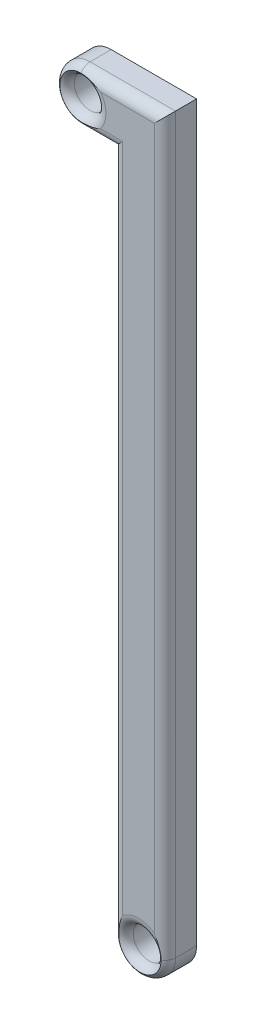
from build123d import *

# Parameters (mm, degrees)
SKETCH1_R           = 1.5
BOSS_EXTRUDE1_DEPTH = 3
FILLET1_R           = 1


with BuildPart() as part:
    # Sketch1 → Boss-Extrude1 (new body)
    with BuildSketch(Plane.XY):
        with BuildLine():
            Line((3.231167374, -4.499889348), (6.321167374, -4.499889348))
            Line((6.321167374, -4.499889348), (6.321167374, -68.999889348))
            ThreePointArc((6.321167374, -68.999889348), (8.821167374, -71.499889348), (11.321167374, -68.999889348))
            Line((11.321167374, -68.999889348), (11.321167374, 0.500110652))
            Line((11.321167374, 0.500110652), (3.231167374, 0.500110652))
            ThreePointArc((3.231167374, 0.500110652), (0.731167374, -1.999889348), (3.231167374, -4.499889348))
        make_face()
        with Locations((3.231167374, -1.999889348)):
            Circle(SKETCH1_R, mode=Mode.SUBTRACT)
        with Locations((8.821167374, -68.999889348)):
            Circle(SKETCH1_R, mode=Mode.SUBTRACT)
    extrude(amount=BOSS_EXTRUDE1_DEPTH)

    # Fillet1
    # the kernel refuses this fillet: 1 mm, written as the material it takes off along each edge
    with BuildSketch(Plane(origin=(8.821167374, -68.999889348, 3), x_dir=(1, 0, 0), z_dir=(0, -1, 0))) as fillet1_piece_1:
        with BuildLine():
            CenterArc((1.5 + FILLET1_R, -FILLET1_R), FILLET1_R, 90, 90)
            Line((1.5 + FILLET1_R, 0), (1.5, 0))
            Line((1.5, 0), (1.5, -FILLET1_R))
        make_face()
    revolve(axis=Axis((8.821167374, -68.999889348, 3), (0, 0, 1)), mode=Mode.SUBTRACT)
    with BuildSketch(Plane(origin=(3.231167374, -1.999889348, 3), x_dir=(1, 0, 0), z_dir=(0, -1, 0))) as fillet1_piece_2:
        with BuildLine():
            CenterArc((1.5 + FILLET1_R, -FILLET1_R), FILLET1_R, 90, 90)
            Line((1.5 + FILLET1_R, 0), (1.5, 0))
            Line((1.5, 0), (1.5, -FILLET1_R))
        make_face()
    revolve(axis=Axis((3.231167374, -1.999889348, 3), (0, 0, 1)), mode=Mode.SUBTRACT)
    with BuildSketch(Plane(origin=(13.821167374, 0.500110652, 3), x_dir=(0, 0, -1), z_dir=(-1, 0, 0))) as fillet1_piece_3:
        with BuildLine():
            CenterArc((FILLET1_R, FILLET1_R), FILLET1_R, 180, 90)
            Line((0, FILLET1_R), (0, 0))
            Line((0, 0), (FILLET1_R, 0))
        make_face()
    extrude(amount=10.59, mode=Mode.SUBTRACT)
    with BuildSketch(Plane(origin=(11.321167374, -68.999889348, 3), x_dir=(0, 0, -1), z_dir=(0, 1, 0))) as fillet1_piece_4:
        with BuildLine():
            CenterArc((FILLET1_R, FILLET1_R), FILLET1_R, 180, 90)
            Line((0, FILLET1_R), (0, 0))
            Line((0, 0), (FILLET1_R, 0))
        make_face()
    extrude(amount=72, mode=Mode.SUBTRACT)
    with BuildSketch(Plane(origin=(8.821167374, -68.999889348, 3), x_dir=(-1, 0, 0), z_dir=(0, 1, 0))) as fillet1_piece_5:
        with BuildLine():
            CenterArc((2.5 - FILLET1_R, -FILLET1_R), FILLET1_R, 0, 90)
            Line((2.5 - FILLET1_R, 0), (2.5, 0))
            Line((2.5, 0), (2.5, -FILLET1_R))
        make_face()
    revolve(axis=Axis((8.821167374, -68.999889348, 3), (0, 0, 1)), revolution_arc=180, mode=Mode.SUBTRACT)
    with BuildSketch(Plane(origin=(6.321167374, -4.499889348, 3), x_dir=(0, 0, -1), z_dir=(0, -1, 0))) as fillet1_piece_6:
        with BuildLine():
            CenterArc((FILLET1_R, FILLET1_R), FILLET1_R, 180, 90)
            Line((0, FILLET1_R), (0, 0))
            Line((0, 0), (FILLET1_R, 0))
        make_face()
    extrude(amount=64.5, mode=Mode.SUBTRACT)
    with BuildSketch(Plane(origin=(3.231167374, -4.499889348, 3), x_dir=(0, 0, -1), z_dir=(1, 0, 0))) as fillet1_piece_7:
        with BuildLine():
            CenterArc((FILLET1_R, FILLET1_R), FILLET1_R, 180, 90)
            Line((0, FILLET1_R), (0, 0))
            Line((0, 0), (FILLET1_R, 0))
        make_face()
    extrude(amount=3.09, mode=Mode.SUBTRACT)
    with BuildSketch(Plane(origin=(3.231167374, -1.999889348, 3), x_dir=(0, 1, 0), z_dir=(1, 0, 0))) as fillet1_piece_8:
        with BuildLine():
            CenterArc((2.5 - FILLET1_R, -FILLET1_R), FILLET1_R, 0, 90)
            Line((2.5 - FILLET1_R, 0), (2.5, 0))
            Line((2.5, 0), (2.5, -FILLET1_R))
        make_face()
    revolve(axis=Axis((3.231167374, -1.999889348, 3), (0, 0, 1)), revolution_arc=180, mode=Mode.SUBTRACT)
    with BuildSketch(Plane(origin=(3.231167374, -4.499889348, 3), x_dir=(0, 0, -1), z_dir=(1, 0, 0))) as fillet1_piece_9a_section:
        with BuildLine():
            CenterArc((FILLET1_R, FILLET1_R), FILLET1_R, 180, 90)
            Line((0, FILLET1_R), (0, 0))
            Line((0, 0), (FILLET1_R, 0))
        make_face()
    fillet1_piece_9a = extrude(amount=5.59, mode=Mode.PRIVATE)
    fillet1_piece_9a = split(fillet1_piece_9a, bisect_by=Plane(origin=(6.321167374, -4.273494233, 2.773604886), z_dir=(1, 0, 0)), keep=Keep.TOP, mode=Mode.PRIVATE)
    with BuildSketch(Plane(origin=(6.321167374, -1.999889348, 3), x_dir=(0, 0, -1), z_dir=(0, -1, 0))) as fillet1_piece_9b_section:
        with BuildLine():
            CenterArc((FILLET1_R, FILLET1_R), FILLET1_R, 180, 90)
            Line((0, FILLET1_R), (0, 0))
            Line((0, 0), (FILLET1_R, 0))
        make_face()
    fillet1_piece_9b = extrude(amount=67, mode=Mode.PRIVATE)
    fillet1_piece_9b = split(fillet1_piece_9b, bisect_by=Plane(origin=(6.547562488, -4.499889348, 2.773604886), z_dir=(0, 1, 0)), keep=Keep.TOP, mode=Mode.PRIVATE)
    fillet1_piece_9 = fillet1_piece_9a & fillet1_piece_9b
    add(fillet1_piece_9, mode=Mode.SUBTRACT)


solid = part.part
